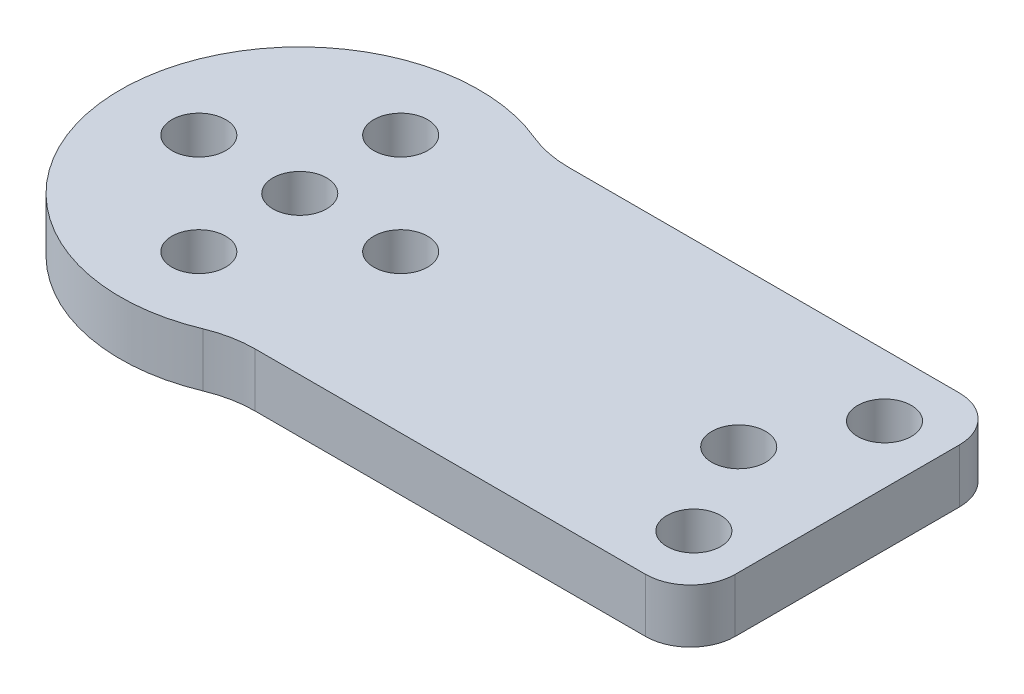
from build123d import *

# Parameters (mm, degrees)
BOSS_EXTRUDE1_DEPTH = 1.2
FILLET1_R           = 2
FILLET2_R           = 5
SKETCH2_R           = 1.2
CUT_EXTRUDE1_DEPTH  = 23.321514286
SKETCH3_R           = 1.2
CUT_EXTRUDE2_DEPTH  = 23.321514286


with BuildPart() as part:
    # Sketch1 → Boss-Extrude1 (new, symmetric)
    with BuildSketch(Plane(origin=(0, 0, 0), x_dir=(1, 0, 0), z_dir=(0, 1, 0))):
        with BuildLine():
            Line((11.716387939, 7), (-8.827016654, 7))
            ThreePointArc((-8.827016654, 7), (-20.7, 0), (-8.827016654, -7))
            Line((-8.827016654, -7), (11.716387939, -7))
            Line((11.716387939, -7), (11.716387939, 7))
        make_face()
    extrude(amount=BOSS_EXTRUDE1_DEPTH, both=True)

    # Fillet1
    fillet1_edges = [part.edges().sort_by_distance(p)[0] for p in [
        (11.716387939, 0, -7),
        (11.716387939, 0, 7),
    ]]
    fillet(fillet1_edges, radius=FILLET1_R)

    # Fillet2
    fillet2_edges = [part.edges().sort_by_distance(p)[0] for p in [
        (-8.827016654, 0, -7),
        (-8.827016654, 0, 7),
    ]]
    fillet(fillet2_edges, radius=FILLET2_R)

    # Sketch2 → Cut-Extrude1 (cut, through all)
    with BuildSketch(Plane(origin=(0, 1.2, 0), x_dir=(1, 0, 0), z_dir=(0, 1, 0))):
        with Locations((-8.2, 0)):
            Circle(SKETCH2_R)
        with Locations((-12.7, 4.5)):
            Circle(SKETCH2_R)
        with Locations((-17.2, 0)):
            Circle(SKETCH2_R)
        with Locations((-12.7, -4.5)):
            Circle(SKETCH2_R)
        with Locations((-12.7, 0)):
            Circle(SKETCH2_R)
    extrude(amount=-CUT_EXTRUDE1_DEPTH, mode=Mode.SUBTRACT)

    # Sketch3 → Cut-Extrude2 (cut, through all)
    with BuildSketch(Plane(origin=(0, 1.2, 0), x_dir=(1, 0, 0), z_dir=(0, 1, 0))):
        with Locations((9.121387939, 4.25)):
            Circle(SKETCH3_R)
        with Locations((9.121387939, -4.25)):
            Circle(SKETCH3_R)
        with Locations((6.871387939, 0)):
            Circle(SKETCH3_R)
    extrude(amount=-CUT_EXTRUDE2_DEPTH, mode=Mode.SUBTRACT)


solid = part.part
